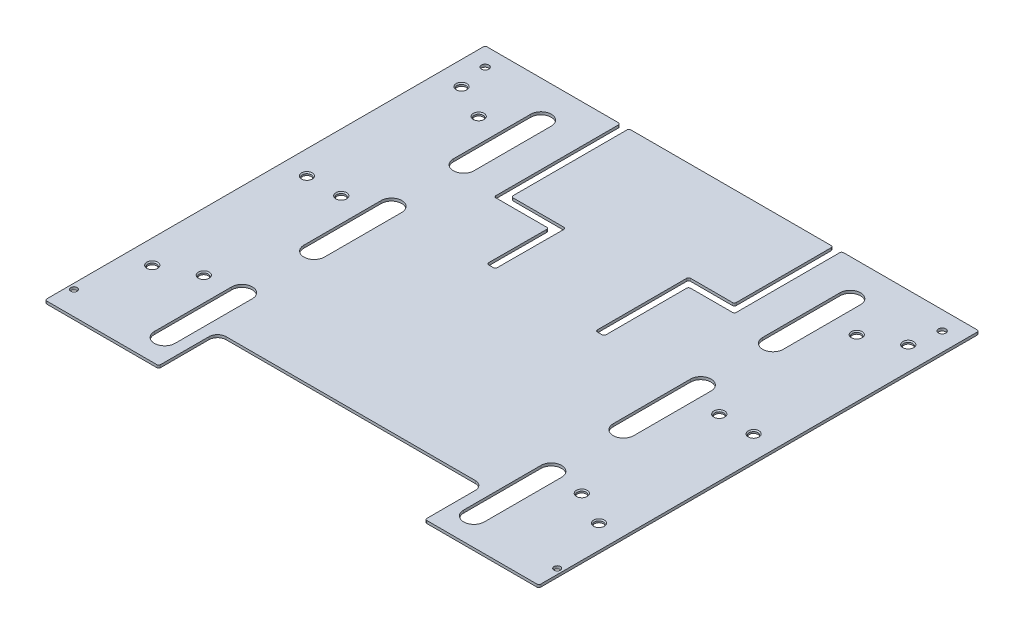
from build123d import *

# Parameters (mm, degrees)
SKETCH1_W                        = 292.1
SKETCH1_H                        = 260.35
SKETCH1_R                        = 2.15265
BOSS_EXTRUDE1_DEPTH              = 1.5875
CUT_EXTRUDE2_DEPTH               = 196.649311988
LPATTERN2_COUNT                  = 3
LPATTERN2_PITCH                  = 88.392
MIRROR1_COPY_1_DEPTH             = 196.649311988
MIRROR1_COPY_2_DEPTH             = 196.649311988
SKETCH6_R                        = 1.89865
CUT_EXTRUDE3_DEPTH               = 196.649311988
SKETCH7_W                        = 157.48
SKETCH7_H                        = 34.798
CUT_EXTRUDE4_DEPTH               = 196.649311988
FILLET1_R                        = 5.08
CUT_EXTRUDE_THIN1_DEPTH          = 196.649311988
FILLET2_R                        = 1.143
F_10_CLEARANCE_HOLE1_AT_2_COUNT  = 2
F_10_CLEARANCE_HOLE1_AT_2_PITCH  = 91.44
F_10_CLEARANCE_HOLE1_AT_3_COUNT  = 2
F_10_CLEARANCE_HOLE1_AT_3_PITCH  = 93.670571686
F_10_CLEARANCE_HOLE1_AT_4_COUNT  = 2
F_10_CLEARANCE_HOLE1_AT_4_PITCH  = 22.718450651
F_10_CLEARANCE_HOLE1_AT_5_COUNT  = 2
F_10_CLEARANCE_HOLE1_AT_5_PITCH  = 182.88
F_10_CLEARANCE_HOLE1_AT_6_COUNT  = 2
F_10_CLEARANCE_HOLE1_AT_6_PITCH  = 173.911186529
F_10_CLEARANCE_HOLE1_AT_7_COUNT  = 2
F_10_CLEARANCE_HOLE1_AT_7_PITCH  = 298.814564571
F_10_CLEARANCE_HOLE1_AT_8_COUNT  = 2
F_10_CLEARANCE_HOLE1_AT_8_PITCH  = 321.287410273
F_10_CLEARANCE_HOLE1_AT_9_COUNT  = 2
F_10_CLEARANCE_HOLE1_AT_9_PITCH  = 279.538511121
F_10_CLEARANCE_HOLE1_AT_10_COUNT = 2
F_10_CLEARANCE_HOLE1_AT_10_PITCH = 260.421234157
F_10_CLEARANCE_HOLE1_AT_11_COUNT = 2
F_10_CLEARANCE_HOLE1_AT_11_PITCH = 244.051574877
F_10_CLEARANCE_HOLE1_AT_12_COUNT = 2
F_10_CLEARANCE_HOLE1_AT_12_PITCH = 264.16


with BuildPart() as part:
    # Sketch1 → Boss-Extrude1 (new body)
    with BuildSketch(Plane(origin=(0, 0, 0), x_dir=(1, 0, 0), z_dir=(0, 1, 0))):
        Rectangle(SKETCH1_W, SKETCH1_H)
        with Locations((-135.128, 119.253)):
            Circle(SKETCH1_R, mode=Mode.SUBTRACT)
        with Locations((135.128, 119.253)):
            Circle(SKETCH1_R, mode=Mode.SUBTRACT)
    extrude(amount=BOSS_EXTRUDE1_DEPTH)

    # Sketch5 → Cut-Extrude2 (cut, through all)
    with BuildSketch(Plane(origin=(0, 1.5875, 0), x_dir=(1, 0, 0), z_dir=(0, 1, 0))):
        with BuildLine():
            Line((-85.344, 108.585), (-85.344, 62.865))
            ThreePointArc((-85.344, 62.865), (-91.44, 56.769), (-97.536, 62.865))
            Line((-97.536, 62.865), (-97.536, 108.585))
            ThreePointArc((-97.536, 108.585), (-91.44, 114.681), (-85.344, 108.585))
        make_face()
    cut_extrude2 = extrude(amount=-CUT_EXTRUDE2_DEPTH, mode=Mode.SUBTRACT)

    # LPattern2: Cut-Extrude2 ×3
    with Locations(*[(0, 0, i * LPATTERN2_PITCH) for i in range(1, LPATTERN2_COUNT)]):
        add(cut_extrude2, mode=Mode.SUBTRACT)

    # Mirror1: Cut-Extrude2 across plane
    add(cut_extrude2.mirror(Plane(origin=(0, 0, 0), x_dir=(0, 0, 1), z_dir=(1, 0, 0))), mode=Mode.SUBTRACT)

    # Mirror1 copy 1 sketch → Mirror1 copy 1 (cut, through all)
    with BuildSketch(Plane(origin=(0, 1.5875, 88.392), x_dir=(-1, 0, 0), z_dir=(0, 1, 0))):
        with BuildLine():
            Line((-85.344, -108.585), (-85.344, -62.865))
            ThreePointArc((-85.344, -62.865), (-91.44, -56.769), (-97.536, -62.865))
            Line((-97.536, -62.865), (-97.536, -108.585))
            ThreePointArc((-97.536, -108.585), (-91.44, -114.681), (-85.344, -108.585))
        make_face()
    extrude(amount=-MIRROR1_COPY_1_DEPTH, mode=Mode.SUBTRACT)

    # Mirror1 copy 2 sketch → Mirror1 copy 2 (cut, through all)
    with BuildSketch(Plane(origin=(0, 1.5875, 176.784), x_dir=(-1, 0, 0), z_dir=(0, 1, 0))):
        with BuildLine():
            Line((-85.344, -108.585), (-85.344, -62.865))
            ThreePointArc((-85.344, -62.865), (-91.44, -56.769), (-97.536, -62.865))
            Line((-97.536, -62.865), (-97.536, -108.585))
            ThreePointArc((-97.536, -108.585), (-91.44, -114.681), (-85.344, -108.585))
        make_face()
    extrude(amount=-MIRROR1_COPY_2_DEPTH, mode=Mode.SUBTRACT)

    # Sketch6 → Cut-Extrude3 (cut, through all)
    with BuildSketch(Plane(origin=(0, 1.5875, 0), x_dir=(1, 0, 0), z_dir=(0, 1, 0))):
        with Locations((-142.875, -116.1542)):
            Circle(SKETCH6_R)
        with Locations((142.875, -116.1542)):
            Circle(SKETCH6_R)
    extrude(amount=-CUT_EXTRUDE3_DEPTH, mode=Mode.SUBTRACT)

    # Sketch7 → Cut-Extrude4 (cut, through all)
    with BuildSketch(Plane(origin=(0, 1.5875, 0), x_dir=(1, 0, 0), z_dir=(0, 1, 0))):
        with Locations((0, -112.776)):
            Rectangle(SKETCH7_W, SKETCH7_H)
    extrude(amount=-CUT_EXTRUDE4_DEPTH, mode=Mode.SUBTRACT)

    # Fillet1
    fillet1_edges = [part.edges().sort_by_distance(p)[0] for p in [
        (78.74, 0.79375, 95.377),
        (-78.74, 0.79375, 95.377),
    ]]
    fillet(fillet1_edges, radius=FILLET1_R)

    # Sketch8 → Cut-Extrude-Thin1 (cut, through all)
    with BuildSketch(Plane(origin=(0, 1.5875, 0), x_dir=(1, 0, 0), z_dir=(0, 1, 0))):
        Polygon((-66.110249977, 132.706112174), (-66.110249977, 55.453312621), (-33.822780613, 55.453312621), (-33.93771403, 18.964499141), (-28.85773923, 18.948498104), (-28.726754296, 60.533312621), (-61.030249977, 60.533312621), (-61.030249977, 132.706112174), align=None)
        Polygon((59.667640221, 130.175), (59.667640221, 71.82733415), (32.604, 71.82733415), (32.604, 16.756255485), (37.684, 16.756255485), (37.684, 66.74733415), (64.747640221, 66.74733415), (64.747640221, 130.175), align=None)
    extrude(amount=-CUT_EXTRUDE_THIN1_DEPTH, mode=Mode.SUBTRACT)

    # Fillet2
    fillet2_edges = [part.edges().sort_by_distance(p)[0] for p in [
        (-146.05, 0.79375, -130.175),
        (-146.05, 0.79375, 130.175),
        (-78.74, 0.79375, 130.175),
        (78.74, 0.79375, 130.175),
        (146.05, 0.79375, 130.175),
        (146.05, 0.79375, -130.175),
        (64.747640221, 0.79375, -130.175),
        (64.747640221, 0.79375, -66.74733415),
        (37.684, 0.79375, -66.74733415),
        (37.684, 0.79375, -16.756255485),
        (32.604, 0.79375, -16.756255485),
        (32.604, 0.79375, -71.82733415),
        (59.667640221, 0.79375, -71.82733415),
        (59.667640221, 0.79375, -130.175),
        (-61.030249977, 0.79375, -130.175),
        (-61.030249977, 0.79375, -60.533312621),
        (-28.726754296, 0.79375, -60.533312621),
        (-28.85773923, 0.79375, -18.948498104),
        (-33.93771403, 0.79375, -18.964499141),
        (-33.822780613, 0.79375, -55.453312621),
        (-66.110249977, 0.79375, -55.453312621),
        (-66.110249977, 0.79375, -130.175),
    ]]
    fillet(fillet2_edges, radius=FILLET2_R)

    # Sketch10 → #10 Clearance Hole1 (revolve, cut)
    with BuildSketch(Plane(origin=(-132.08, 1.5875, -102.235), x_dir=(0, 0, 1), z_dir=(1, 0, 0))):
        Polygon((0, 0), (0, 1.5875), (2.5527, 1.5875), (2.5527, 0.635), (3.1877, 0), align=None)
    f_10_clearance_hole1 = revolve(axis=Axis((-132.08, 7.9375, -102.235), (0, -1, 0)), mode=Mode.SUBTRACT)

    # #10 Clearance Hole1 at 2: #10 Clearance Hole1 ×2
    with Locations(*[(0, 0, i * F_10_CLEARANCE_HOLE1_AT_2_PITCH) for i in range(1, F_10_CLEARANCE_HOLE1_AT_2_COUNT)]):
        add(f_10_clearance_hole1, mode=Mode.SUBTRACT)

    # #10 Clearance Hole1 at 3: #10 Clearance Hole1 ×2
    with Locations(*[Vector(0.21693045781865608, 0, 0.9761870601839528) * (i * F_10_CLEARANCE_HOLE1_AT_3_PITCH) for i in range(1, F_10_CLEARANCE_HOLE1_AT_3_COUNT)]):
        add(f_10_clearance_hole1, mode=Mode.SUBTRACT)

    # #10 Clearance Hole1 at 4: #10 Clearance Hole1 ×2
    with Locations(*[Vector(0.894427190999916, 0, 0.447213595499958) * (i * F_10_CLEARANCE_HOLE1_AT_4_PITCH) for i in range(1, F_10_CLEARANCE_HOLE1_AT_4_COUNT)]):
        add(f_10_clearance_hole1, mode=Mode.SUBTRACT)

    # #10 Clearance Hole1 at 5: #10 Clearance Hole1 ×2
    with Locations(*[(0, 0, i * F_10_CLEARANCE_HOLE1_AT_5_PITCH) for i in range(1, F_10_CLEARANCE_HOLE1_AT_5_COUNT)]):
        add(f_10_clearance_hole1, mode=Mode.SUBTRACT)

    # #10 Clearance Hole1 at 6: #10 Clearance Hole1 ×2
    with Locations(*[Vector(0.11684124756739715, 0, 0.9931506043228763) * (i * F_10_CLEARANCE_HOLE1_AT_6_PITCH) for i in range(1, F_10_CLEARANCE_HOLE1_AT_6_COUNT)]):
        add(f_10_clearance_hole1, mode=Mode.SUBTRACT)

    # #10 Clearance Hole1 at 7: #10 Clearance Hole1 ×2
    with Locations(*[Vector(0.8160244811016552, 0, 0.5780173407803391) * (i * F_10_CLEARANCE_HOLE1_AT_7_PITCH) for i in range(1, F_10_CLEARANCE_HOLE1_AT_7_COUNT)]):
        add(f_10_clearance_hole1, mode=Mode.SUBTRACT)

    # #10 Clearance Hole1 at 8: #10 Clearance Hole1 ×2
    with Locations(*[Vector(0.8221921916437785, 0, 0.5692099788303084) * (i * F_10_CLEARANCE_HOLE1_AT_8_PITCH) for i in range(1, F_10_CLEARANCE_HOLE1_AT_8_COUNT)]):
        add(f_10_clearance_hole1, mode=Mode.SUBTRACT)

    # #10 Clearance Hole1 at 9: #10 Clearance Hole1 ×2
    with Locations(*[Vector(0.9449860734402581, 0, 0.32711056388316634) * (i * F_10_CLEARANCE_HOLE1_AT_9_PITCH) for i in range(1, F_10_CLEARANCE_HOLE1_AT_9_COUNT)]):
        add(f_10_clearance_hole1, mode=Mode.SUBTRACT)

    # #10 Clearance Hole1 at 10: #10 Clearance Hole1 ×2
    with Locations(*[Vector(0.9363291775690445, 0, 0.3511234415883917) * (i * F_10_CLEARANCE_HOLE1_AT_10_PITCH) for i in range(1, F_10_CLEARANCE_HOLE1_AT_10_COUNT)]):
        add(f_10_clearance_hole1, mode=Mode.SUBTRACT)

    # #10 Clearance Hole1 at 11: #10 Clearance Hole1 ×2
    with Locations(*[Vector(0.999133073092352, 0, 0.04163054471218132) * (i * F_10_CLEARANCE_HOLE1_AT_11_PITCH) for i in range(1, F_10_CLEARANCE_HOLE1_AT_11_COUNT)]):
        add(f_10_clearance_hole1, mode=Mode.SUBTRACT)

    # #10 Clearance Hole1 at 12: #10 Clearance Hole1 ×2
    with Locations(*[(i * F_10_CLEARANCE_HOLE1_AT_12_PITCH, 0, 0) for i in range(1, F_10_CLEARANCE_HOLE1_AT_12_COUNT)]):
        add(f_10_clearance_hole1, mode=Mode.SUBTRACT)


solid = part.part
